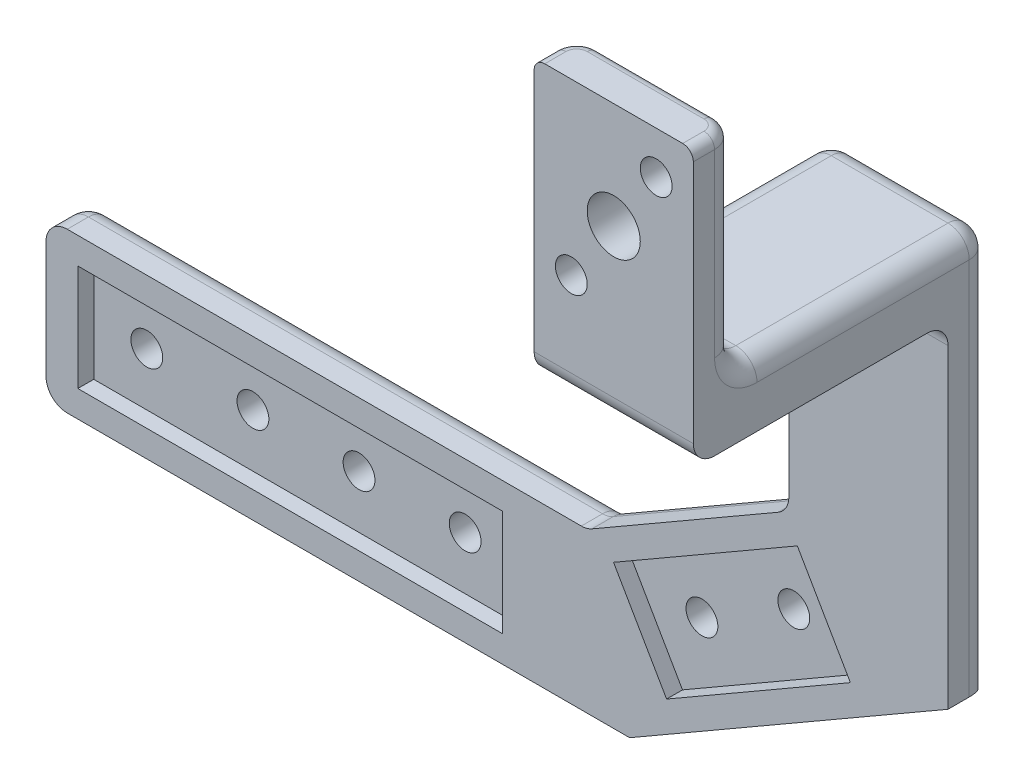
from build123d import *

# Parameters (mm, degrees)
SKETCH_1_W          = 15
SKETCH_1_H          = 26
SKETCH_1_R          = 2.5
SKETCH_1_R_2        = 1.5
EXTRUDE_1_DEPTH     = 4
SKETCH_3_W          = 15
SKETCH_3_H          = 6
EXTRUDE_2_DEPTH     = 20
EXTRUDE_3_DEPTH     = 4
SKETCH_9_W          = 40
SKETCH_9_H          = 10
CUT_EXTRUDE_1_DEPTH = 1.5
SKETCH_10_R         = 1.5
CUT_EXTRUDE_2_DEPTH = 4
CUT_EXTRUDE_3_DEPTH = 1.5
SKETCH_12_R         = 1.5
CUT_EXTRUDE_4_DEPTH = 10
FILLET_1_R          = 2
FILLET_2_R          = 2
FILLET_3_R          = 1


with BuildPart() as part:
    # 草图1 → 凸台-拉伸1 (new body)
    with BuildSketch(Plane.XY):
        with Locations((0, -3)):
            Rectangle(SKETCH_1_W, SKETCH_1_H)
        Circle(SKETCH_1_R, mode=Mode.SUBTRACT)
        with Locations((4, 6)):
            Circle(SKETCH_1_R_2, mode=Mode.SUBTRACT)
        with Locations((-4, -6)):
            Circle(SKETCH_1_R_2, mode=Mode.SUBTRACT)
    extrude(amount=EXTRUDE_1_DEPTH)

    # 草图3 → 凸台-拉伸2 (add)
    with BuildSketch(Plane(origin=(0, 0, 0), x_dir=(-1, 0, 0), z_dir=(0, 0, -1))):
        with Locations((0, -13)):
            Rectangle(SKETCH_3_W, SKETCH_3_H)
    extrude(amount=EXTRUDE_2_DEPTH)

    # 草图8 → 凸台-拉伸3 (add)
    with BuildSketch(Plane(origin=(0, 0, -20), x_dir=(-1, 0, 0), z_dir=(0, 0, -1))):
        Polygon((-7.5, -16), (-7.5, -47.679491924), (22.5, -65), (77.5, -65), (77.5, -50), (26.519237886, -50), (7.5, -39.019237886), (7.5, -16), (7.5, -10), (-7.5, -10), align=None)
    extrude(amount=EXTRUDE_3_DEPTH)

    # 草图9 → 切除-拉伸1 (cut)
    with BuildSketch(Plane.XY.offset(-20)):
        with Locations((-54.5, -57.5)):
            Rectangle(SKETCH_9_W, SKETCH_9_H)
    extrude(amount=-CUT_EXTRUDE_1_DEPTH, mode=Mode.SUBTRACT)

    # 草图10 → 切除-拉伸2 (cut)
    with BuildSketch(Plane.XY.offset(-21.5)):
        with Locations((-69.5, -57.5)):
            Circle(SKETCH_10_R)
        with Locations((-59.5, -57.5)):
            Circle(SKETCH_10_R)
        with Locations((-49.5, -57.5)):
            Circle(SKETCH_10_R)
        with Locations((-39.5, -57.5)):
            Circle(SKETCH_10_R)
    extrude(amount=-CUT_EXTRUDE_2_DEPTH, mode=Mode.SUBTRACT)

    # 草图11 → 切除-拉伸3 (cut)
    with BuildSketch(Plane.XY.offset(-20)):
        Polygon((-6.698729811, -41.443375673), (-24.019237886, -51.443375673), (-19.019237886, -60.103629711), (-1.698729811, -50.103629711), align=None)
    extrude(amount=-CUT_EXTRUDE_3_DEPTH, mode=Mode.SUBTRACT)

    # 草图12 → 切除-拉伸4 (cut)
    with BuildSketch(Plane.XY.offset(-21.5)):
        with Locations((-17.189110868, -53.273502692)):
            Circle(SKETCH_12_R)
        with Locations((-8.52885683, -48.273502692)):
            Circle(SKETCH_12_R)
    extrude(amount=-CUT_EXTRUDE_4_DEPTH, mode=Mode.SUBTRACT)

    # 圆角1
    fillet_1_edges = [part.edges().sort_by_distance(p)[0] for p in [
        (7.5, 0, 0),
        (7.5, -10, -12),
        (0, -10, 0),
        (-7.5, -10, -12),
        (0, -16, -20),
        (-77.5, -65, -22),
        (-77.5, -50, -22),
        (-26.519237886, -50, -22),
        (-7.5, -39.019237886, -22),
        (0, -10, -24),
        (7.5, -28.839745962, -24),
        (-50, -65, -24),
        (-77.5, -57.5, -24),
        (-52.009618943, -50, -24),
        (-17.009618943, -44.509618943, -24),
        (-7.5, -24.509618943, -24),
        (-7.5, 0, 0),
    ]]
    fillet(fillet_1_edges, radius=FILLET_1_R - 0.0001)  # a hair under: the kernel refuses the full size

    # 圆角2
    fillet_2_edges = [part.edges().sort_by_distance(p)[0] for p in [
        (0, -16, 4),
    ]]
    fillet(fillet_2_edges, radius=FILLET_2_R)

    # 圆角3
    fillet_3_edges = [part.edges().sort_by_distance(p)[0] for p in [
        (0, 10, 0),
        (-6.914242852, 10, 0.585757148),
        (6.914242852, 10, 0.585757148),
        (-7.5, 10, 2.99995),
        (7.5, 10, 2.99995),
    ]]
    fillet(fillet_3_edges, radius=FILLET_3_R)


solid = part.part
